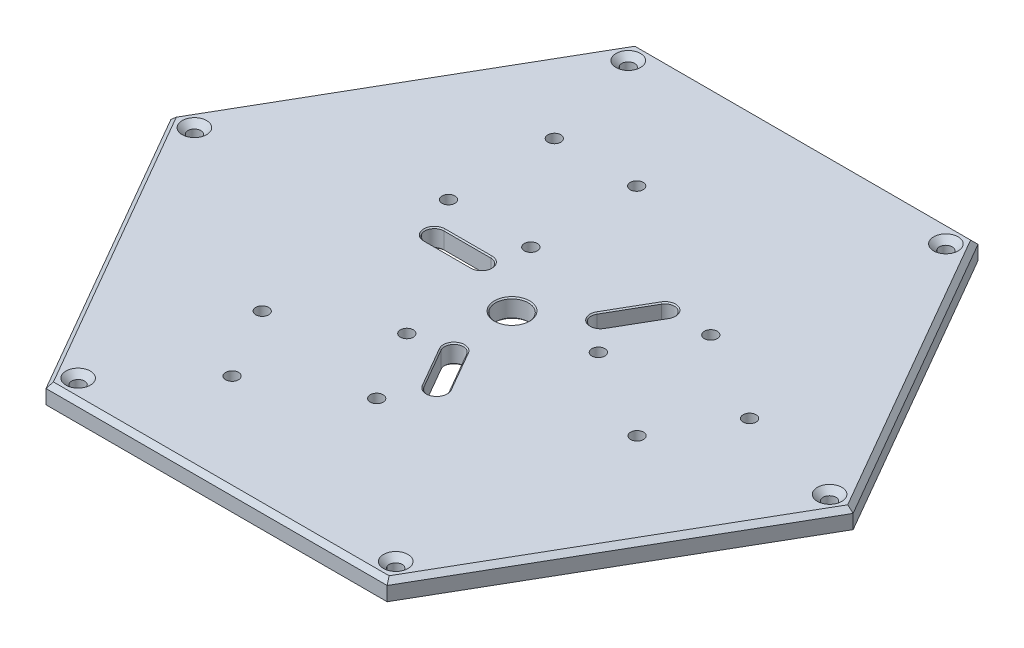
from build123d import *

# Parameters (mm, degrees)
BOSS_EXTRUDE1_DEPTH                             = 8
SKETCH5_R                                       = 7
CUT_EXTRUDE1_DEPTH                              = 192.983723268
CSK_FOR_M5_FLAT_HEAD_MACHINE_SCREW1_D           = 5.5
CSK_FOR_M5_FLAT_HEAD_MACHINE_SCREW1_CSINK_D     = 10.4
CSK_FOR_M5_FLAT_HEAD_MACHINE_SCREW1_CSINK_ANGLE = 90
CUT_EXTRUDE3_DEPTH                              = 192.983723268
CSK_FOR_M5_FLAT_HEAD_MACHINE_SCREW2_D           = 5.5
CSK_FOR_M5_FLAT_HEAD_MACHINE_SCREW2_DEPTH       = 10
CSK_FOR_M5_FLAT_HEAD_MACHINE_SCREW2_CSINK_D     = 10.4
CSK_FOR_M5_FLAT_HEAD_MACHINE_SCREW2_CSINK_ANGLE = 90
CSK_FOR_M5_FLAT_HEAD_MACHINE_SCREW2_TIP         = 1.652366702
CHAMFER1_SIZE                                   = 0.5
CHAMFER3_SIZE                                   = 0.5
CHAMFER4_SIZE                                   = 2


with BuildPart() as part:
    # Sketch1 → Boss-Extrude1 (new body)
    with BuildSketch(Plane(origin=(0, 0, 0), x_dir=(1, 0, 0), z_dir=(0, 1, 0))):
        Polygon((72.5, 125.573683549), (-72.5, 125.573683549), (-145, 0), (-72.5, -125.573683549), (72.5, -125.573683549), (145, 0), align=None)
    extrude(amount=BOSS_EXTRUDE1_DEPTH)

    # Sketch5 → Cut-Extrude1 (cut, through all)
    with BuildSketch(Plane(origin=(0, 8, 0), x_dir=(1, 0, 0), z_dir=(0, 1, 0))):
        Circle(SKETCH5_R)
    extrude(amount=-CUT_EXTRUDE1_DEPTH, mode=Mode.SUBTRACT)

    # CSK for M5 Flat Head Machine Screw1 (through all)
    with Locations(Plane(origin=(0, 0, 0), x_dir=(-1, 0, 0), z_dir=(0, -1, 0))):
        with Locations((54.5, 27.5), (19.5, 27.5), (19.5, 72.5), (54.5, 72.5), (-33.565698604, 3.137495374), (-72.536841774, -19.362504626), (-90.036841774, 10.948384506), (-51.065698604, 33.448384506), (14.065698604, -30.637495374), (-3.434301396, -60.948384506), (35.536841774, -83.448384506), (53.036841774, -53.137495374)):
            CounterSinkHole(CSK_FOR_M5_FLAT_HEAD_MACHINE_SCREW1_D / 2, CSK_FOR_M5_FLAT_HEAD_MACHINE_SCREW1_CSINK_D / 2, counter_sink_angle=CSK_FOR_M5_FLAT_HEAD_MACHINE_SCREW1_CSINK_ANGLE)

    # Sketch9 → Cut-Extrude3 (cut, through all)
    with BuildSketch(Plane.XZ):
        with BuildLine():
            Line((28.745190528, -34.788130468), (18.745190528, -17.467622393))
            ThreePointArc((18.745190528, -17.467622393), (20.209292144, -12.003520778), (25.673393759, -13.467622393))
            Line((25.673393759, -13.467622393), (35.673393759, -30.788130468))
            ThreePointArc((35.673393759, -30.788130468), (34.209292144, -36.252232084), (28.745190528, -34.788130468))
        make_face()
        with BuildLine():
            Line((-44.5, -7.5), (-24.5, -7.5))
            ThreePointArc((-24.5, -7.5), (-20.5, -11.5), (-24.5, -15.5))
            Line((-24.5, -15.5), (-44.5, -15.5))
            ThreePointArc((-44.5, -15.5), (-48.5, -11.5), (-44.5, -7.5))
        make_face()
        with BuildLine():
            Line((15.754809472, 42.288130468), (5.754809472, 24.967622393))
            ThreePointArc((5.754809472, 24.967622393), (0.290707856, 23.503520778), (-1.173393759, 28.967622393))
            Line((-1.173393759, 28.967622393), (8.826606241, 46.288130468))
            ThreePointArc((8.826606241, 46.288130468), (14.290707856, 47.752232084), (15.754809472, 42.288130468))
        make_face()
    extrude(amount=-CUT_EXTRUDE3_DEPTH, mode=Mode.SUBTRACT)

    # CSK for M5 Flat Head Machine Screw2
    with Locations(Plane(origin=(0, 8, 0), x_dir=(1, 0, 0), z_dir=(0, 1, 0))):
        with Locations((-135, 0), (-67.5, -116.913429511), (67.5, -116.913429511), (135, 0), (67.5, 116.913429511), (-67.5, 116.913429511)):
            CounterSinkHole(CSK_FOR_M5_FLAT_HEAD_MACHINE_SCREW2_D / 2, CSK_FOR_M5_FLAT_HEAD_MACHINE_SCREW2_CSINK_D / 2, depth=CSK_FOR_M5_FLAT_HEAD_MACHINE_SCREW2_DEPTH, counter_sink_angle=CSK_FOR_M5_FLAT_HEAD_MACHINE_SCREW2_CSINK_ANGLE)
            with Locations((0, 0, -(CSK_FOR_M5_FLAT_HEAD_MACHINE_SCREW2_DEPTH + CSK_FOR_M5_FLAT_HEAD_MACHINE_SCREW2_TIP / 2))):  # 118° drill point
                Cone(0, CSK_FOR_M5_FLAT_HEAD_MACHINE_SCREW2_D / 2, CSK_FOR_M5_FLAT_HEAD_MACHINE_SCREW2_TIP, mode=Mode.SUBTRACT)

    # Chamfer1
    chamfer1_edges = [part.edges().sort_by_distance(p)[0] for p in [
        (-34.5, 0, -15.5),
        (-20.5, 0, -11.5),
        (-48.5, 0, -11.5),
        (-34.5, 0, -7.5),
        (23.745190528, 0, -26.127876431),
        (34.209292144, 0, -36.252232084),
        (20.209292144, 0, -12.003520778),
        (30.673393759, 0, -22.127876431),
        (3.826606241, 0, 37.627876431),
        (0.290707856, 0, 23.503520778),
        (14.290707856, 0, 47.752232084),
        (10.754809472, 0, 33.627876431),
        (-34.5, 8, -15.5),
        (-20.5, 8, -11.5),
        (-48.5, 8, -11.5),
        (-34.5, 8, -7.5),
        (23.745190528, 8, -26.127876431),
        (34.209292144, 8, -36.252232084),
        (20.209292144, 8, -12.003520778),
        (30.673393759, 8, -22.127876431),
        (3.826606241, 8, 37.627876431),
        (0.290707856, 8, 23.503520778),
        (14.290707856, 8, 47.752232084),
        (10.754809472, 8, 33.627876431),
    ]]
    chamfer(chamfer1_edges, length=CHAMFER1_SIZE)

    # Chamfer3
    chamfer3_edges = [part.edges().sort_by_distance(p)[0] for p in [
        (-7, 8, 0),
        (-7, 0, 0),
    ]]
    chamfer(chamfer3_edges, length=CHAMFER3_SIZE)

    # Chamfer4
    chamfer4_edges = [part.edges().sort_by_distance(p)[0] for p in [
        (0, 8, 125.573683549),
        (108.75, 8, 62.786841774),
        (108.75, 8, -62.786841774),
        (0, 8, -125.573683549),
        (-108.75, 8, -62.786841774),
        (-108.75, 8, 62.786841774),
    ]]
    chamfer(chamfer4_edges, length=CHAMFER4_SIZE)


solid = part.part
